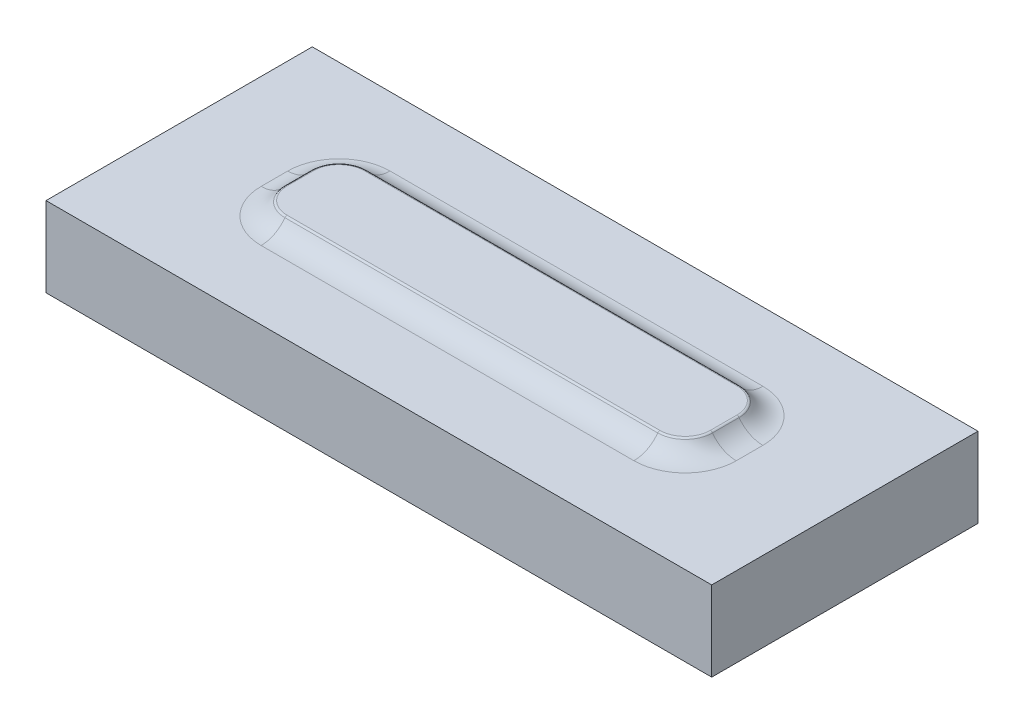
from build123d import *

# Parameters (mm, degrees)
SKETCH_1_W      = 25
SKETCH_1_H      = 10
EXTRUDE_1_DEPTH = 3
EXTRUDE_2_DEPTH = 0.5
FILLET_1_R      = 1.1
FILLET_2_R      = 0.1


with BuildPart() as part:
    # 草图1 → 凸台-拉伸1 (new body)
    with BuildSketch(Plane(origin=(0, 0, 0), x_dir=(1, 0, 0), z_dir=(0, 1, 0))):
        Rectangle(SKETCH_1_W, SKETCH_1_H)
    extrude(amount=EXTRUDE_1_DEPTH)

    # 草图2 → 凸台-拉伸2 (add)
    with BuildSketch(Plane(origin=(0, 3, 0), x_dir=(1, 0, 0), z_dir=(0, 1, 0))):
        with BuildLine():
            Line((7, 1.5), (-7, 1.5))
            ThreePointArc((-7, 1.5), (-7.707106781, 1.207106781), (-8, 0.5))
            Line((-8, 0.5), (-8, -0.5))
            ThreePointArc((-8, -0.5), (-7.707106781, -1.207106781), (-7, -1.5))
            Line((-7, -1.5), (7, -1.5))
            ThreePointArc((7, -1.5), (7.707106781, -1.207106781), (8, -0.5))
            Line((8, -0.5), (8, 0.5))
            ThreePointArc((8, 0.5), (7.707106781, 1.207106781), (7, 1.5))
        make_face()
    extrude(amount=EXTRUDE_2_DEPTH)

    # 圆角1
    # the kernel refuses this fillet: 1.1 mm, written as the material it adds along each edge
    with BuildSketch(Plane(origin=(-7, 3, 0.5), x_dir=(-1, 0, 0), z_dir=(0, 0, -1))) as fillet_1_piece_1:
        with BuildLine():
            CenterArc((1.921954446, 1.1), FILLET_1_R, 213.055731151, 56.944268849)
            Line((1, 0.5), (0.981560911, 0.488))
            ThreePointArc((0.981560911, 0.488), (0.978, 0.25), (0.978, 0))
            Line((0.978, 0), (1, -0.022))
            Line((1, -0.022), (1.921954446, -0.022))
            Line((1.921954446, -0.022), (1.921954446, 0))
        make_face()
    revolve(axis=Axis((-7, 3, 0.5), (0, 1, 0)), revolution_arc=90)
    with BuildSketch(Plane(origin=(-8, 3, -0.5), x_dir=(-1, 0, 0), z_dir=(0, 0, 1)), Plane(origin=(8, 3, 0.5), x_dir=(1, 0, 0), z_dir=(0, 0, -1))) as fillet_1_piece_2:
        with BuildLine():
            CenterArc((0.921954446, -1.1), FILLET_1_R, 90, 56.944268849)
            Line((0, -0.5), (-0.018439089, -0.488))
            ThreePointArc((-0.018439089, -0.488), (-0.022, -0.25), (-0.022, 0))
            Line((-0.022, 0), (0, 0.022))
            Line((0, 0.022), (0.921954446, 0.022))
            Line((0.921954446, 0.022), (0.921954446, 0))
        make_face()
    extrude(amount=1)
    with BuildSketch(Plane(origin=(-7, 3, -0.5), x_dir=(0, 0, -1), z_dir=(1, 0, 0))) as fillet_1_piece_3:
        with BuildLine():
            CenterArc((1.921954446, 1.1), FILLET_1_R, 213.055731151, 56.944268849)
            Line((1, 0.5), (0.981560911, 0.488))
            ThreePointArc((0.981560911, 0.488), (0.978, 0.25), (0.978, 0))
            Line((0.978, 0), (1, -0.022))
            Line((1, -0.022), (1.921954446, -0.022))
            Line((1.921954446, -0.022), (1.921954446, 0))
        make_face()
    revolve(axis=Axis((-7, 3, -0.5), (0, 1, 0)), revolution_arc=90)
    with BuildSketch(Plane(origin=(7, 3, -1.5), x_dir=(0, 0, -1), z_dir=(-1, 0, 0)), Plane(origin=(-7, 3, 1.5), x_dir=(0, 0, 1), z_dir=(1, 0, 0))) as fillet_1_piece_4:
        with BuildLine():
            CenterArc((0.921954446, -1.1), FILLET_1_R, 90, 56.944268849)
            Line((0, -0.5), (-0.018439089, -0.488))
            ThreePointArc((-0.018439089, -0.488), (-0.022, -0.25), (-0.022, 0))
            Line((-0.022, 0), (0, 0.022))
            Line((0, 0.022), (0.921954446, 0.022))
            Line((0.921954446, 0.022), (0.921954446, 0))
        make_face()
    extrude(amount=14)
    with BuildSketch(Plane(origin=(7, 3, -0.5), x_dir=(1, 0, 0), z_dir=(0, 0, 1))) as fillet_1_piece_5:
        with BuildLine():
            CenterArc((1.921954446, 1.1), FILLET_1_R, 213.055731151, 56.944268849)
            Line((1, 0.5), (0.981560911, 0.488))
            ThreePointArc((0.981560911, 0.488), (0.978, 0.25), (0.978, 0))
            Line((0.978, 0), (1, -0.022))
            Line((1, -0.022), (1.921954446, -0.022))
            Line((1.921954446, -0.022), (1.921954446, 0))
        make_face()
    revolve(axis=Axis((7, 3, -0.5), (0, 1, 0)), revolution_arc=90)
    with BuildSketch(Plane(origin=(7, 3, 0.5), x_dir=(0, 0, 1), z_dir=(-1, 0, 0))) as fillet_1_piece_6:
        with BuildLine():
            CenterArc((1.921954446, 1.1), FILLET_1_R, 213.055731151, 56.944268849)
            Line((1, 0.5), (0.981560911, 0.488))
            ThreePointArc((0.981560911, 0.488), (0.978, 0.25), (0.978, 0))
            Line((0.978, 0), (1, -0.022))
            Line((1, -0.022), (1.921954446, -0.022))
            Line((1.921954446, -0.022), (1.921954446, 0))
        make_face()
    revolve(axis=Axis((7, 3, 0.5), (0, 1, 0)), revolution_arc=90)

    # 圆角2
    fillet_2_edges = [part.edges().sort_by_distance(p)[0] for p in [
        (-7.707106781, 3.5, 1.207106781),
        (0, 3.5, 1.5),
        (7.707106781, 3.5, 1.207106781),
        (8, 3.5, 0),
        (7.707106781, 3.5, -1.207106781),
        (0, 3.5, -1.5),
        (-7.707106781, 3.5, -1.207106781),
        (-8, 3.5, 0),
    ]]
    fillet(fillet_2_edges, radius=FILLET_2_R)


solid = part.part
